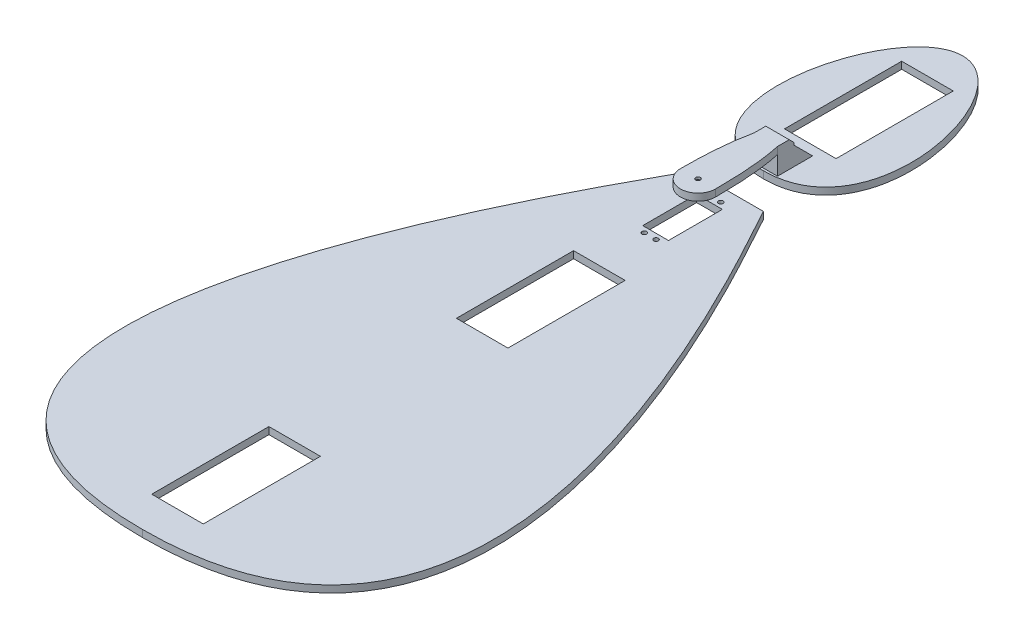
from build123d import *

# Parameters (mm, degrees)
ESQUISSE1_R             = 1
ESQUISSE1_W             = 22
ESQUISSE1_H             = 50
ESQUISSE1_W_2           = 11
ESQUISSE1_H_2           = 23
BOSS_EXTRU_1_DEPTH      = 3
ESQUISSE2_W             = 22
ESQUISSE2_H             = 50
BOSS_EXTRU_2_DEPTH      = 3
ESQUISSE3_W             = 10
ESQUISSE3_H             = 15
BOSS_EXTRU_3_DEPTH      = 8
CHANFREIN1_SIZE         = 8
BOSS_EXTRU_4_DEPTH      = 3
CHANFREIN2_SIZE         = 2
ESQUISSE6_R             = 1
ENL_V_MAT_EXTRU_1_DEPTH = 258.561296602
ESQUISSE7_R             = 2
ENL_V_MAT_EXTRU_2_DEPTH = 2
ESQUISSE8_R             = 5
ESQUISSE8_R_2           = 2
BOSS_EXTRU_6_DEPTH      = 3
CHANFREIN4_SIZE         = 2


with BuildPart() as part:
    # Esquisse1 → Boss.-Extru.1 (new body)
    with BuildSketch(Plane(origin=(0, 0, 0), x_dir=(1, 0, 0), z_dir=(0, 1, 0))):
        with BuildLine():
            Line((-15, 145), (15, 145))
            add(Edge.make_bspline(
                [(0, -105), (166.943450625, -105), (16.604601174, 139.714741184), (15, 145)],
                knots=[0, 0, 0, 0, 1, 1, 1, 1], degree=3))
            add(Edge.make_bspline(
                [(0, -105), (-166.943450625, -105), (-16.604601174, 139.714741184), (-15, 145)],
                knots=[0, 0, 0, 0, 1, 1, 1, 1], degree=3))
        make_face()
        with Locations(Location((-2.5, 139.3, 0), (0, 0, 270))):
            Circle(ESQUISSE1_R, mode=Mode.SUBTRACT)
        with Locations(Location((2.5, 139.3, 0), (0, 0, 90))):
            Circle(ESQUISSE1_R, mode=Mode.SUBTRACT)
        with Locations(Location((2.5, 111.7, 0), (0, 0, 270))):
            Circle(ESQUISSE1_R, mode=Mode.SUBTRACT)
        with Locations(Location((-2.5, 111.7, 0), (0, 0, 90))):
            Circle(ESQUISSE1_R, mode=Mode.SUBTRACT)
        with Locations((0, 65)):
            Rectangle(ESQUISSE1_W, ESQUISSE1_H, mode=Mode.SUBTRACT)
        with Locations((0, -65)):
            Rectangle(ESQUISSE1_W, ESQUISSE1_H, mode=Mode.SUBTRACT)
        with Locations((0, 125.5)):
            Rectangle(ESQUISSE1_W_2, ESQUISSE1_H_2, mode=Mode.SUBTRACT)
    extrude(amount=BOSS_EXTRU_1_DEPTH)


with BuildPart() as body_2:
    # Esquisse2 → Boss.-Extru.2 (new body)
    with BuildSketch(Plane(origin=(0, 0, 0), x_dir=(1, 0, 0), z_dir=(0, 1, 0))):
        with BuildLine():
            add(Edge.make_bspline(
                [(0, 160), (-47.180000793, 160), (-27.677186142, 245), (0, 245)],
                knots=[0, 0, 0, 0, 1, 1, 1, 1], degree=3))
            add(Edge.make_bspline(
                [(0, 160), (47.180000793, 160), (27.677186142, 245), (0, 245)],
                knots=[0, 0, 0, 0, 1, 1, 1, 1], degree=3))
        make_face()
        with Locations((0, 205)):
            Rectangle(ESQUISSE2_W, ESQUISSE2_H, mode=Mode.SUBTRACT)
    extrude(amount=BOSS_EXTRU_2_DEPTH)

    # Esquisse3 → Boss.-Extru.3 (add)
    with BuildSketch(Plane(origin=(0, 3, 0), x_dir=(1, 0, 0), z_dir=(0, 1, 0))):
        with Locations((0, 168.5)):
            Rectangle(ESQUISSE3_W, ESQUISSE3_H)
    extrude(amount=BOSS_EXTRU_3_DEPTH)

    # Chanfrein1
    chanfrein1_edges = [body_2.edges().sort_by_distance(p)[0] for p in [
        (0, 11, -176),
    ]]
    chamfer(chanfrein1_edges, length=CHANFREIN1_SIZE - 0.0001)  # a hair under: the kernel refuses the full size

    # Esquisse4 → Boss.-Extru.4 (add)
    with BuildSketch(Plane(origin=(0, 11, 0), x_dir=(1, 0, 0), z_dir=(0, 1, 0))):
        with BuildLine():
            Line((-5, 161), (-5, 168))
            Line((-5, 168), (5, 168))
            Line((5, 168), (5, 161))
            add(Edge.make_bspline(
                [(7.5, 132.10118803), (7.5, 149.93844942), (5, 161)],
                knots=[0, 0, 0, 1, 1, 1], degree=2))
            ThreePointArc((7.5, 132.10118803), (0, 124.60118803), (-7.5, 132.10118803))
            add(Edge.make_bspline(
                [(-7.5, 132.10118803), (-7.5, 149.93844942), (-5, 161)],
                knots=[0, 0, 0, 1, 1, 1], degree=2))
        make_face()
    extrude(amount=BOSS_EXTRU_4_DEPTH)

    # Chanfrein2
    chanfrein2_edges = [body_2.edges().sort_by_distance(p)[0] for p in [
        (0, 14, -168),
    ]]
    chamfer(chanfrein2_edges, length=CHANFREIN2_SIZE)

    # Esquisse6 → Enlèv. mat.-Extru.1 (cut, through all)
    with BuildSketch(Plane.XZ.offset(-11)):
        with Locations(Location((0, -132.10118803, 0), (0, 0, 270))):
            Circle(ESQUISSE6_R)
    extrude(amount=-ENL_V_MAT_EXTRU_1_DEPTH, mode=Mode.SUBTRACT)

    # Esquisse7 → Enlèv. mat.-Extru.2 (cut)
    with BuildSketch(Plane.XZ.offset(-11)):
        with Locations(Location((0, -132.10118803, 0), (0, 0, 270))):
            Circle(ESQUISSE7_R)
    extrude(amount=-ENL_V_MAT_EXTRU_2_DEPTH, mode=Mode.SUBTRACT)

    # Esquisse8 → Boss.-Extru.6 (add)
    with BuildSketch(Plane.XZ.offset(-11)):
        with Locations(Location((0, -132.10118803, 0), (0, 0, 90))):
            Circle(ESQUISSE8_R)
        with Locations(Location((0, -132.10118803, 0), (0, 0, 270))):
            Circle(ESQUISSE8_R_2, mode=Mode.SUBTRACT)
    extrude(amount=BOSS_EXTRU_6_DEPTH)

    # Chanfrein4
    chanfrein4_edges = [body_2.edges().sort_by_distance(p)[0] for p in [
        (0, 8, -137.10118803),
    ]]
    chamfer(chanfrein4_edges, length=CHANFREIN4_SIZE)


solid = Compound([part.part, body_2.part])
